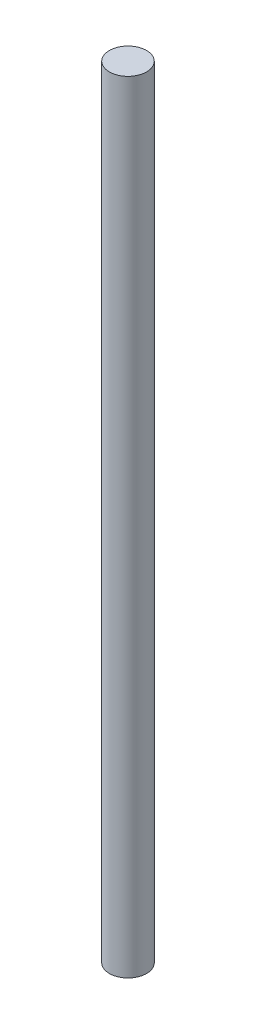
from build123d import *

# Parameters (mm, degrees)
SKETCH1_R           = 4.7625
BOSS_EXTRUDE1_DEPTH = 200


with BuildPart() as part:
    # Sketch1 → Boss-Extrude1 (new body)
    with BuildSketch(Plane(origin=(0, 0, 0), x_dir=(1, 0, 0), z_dir=(0, 1, 0))):
        Circle(SKETCH1_R)
    extrude(amount=BOSS_EXTRUDE1_DEPTH)


solid = part.part
